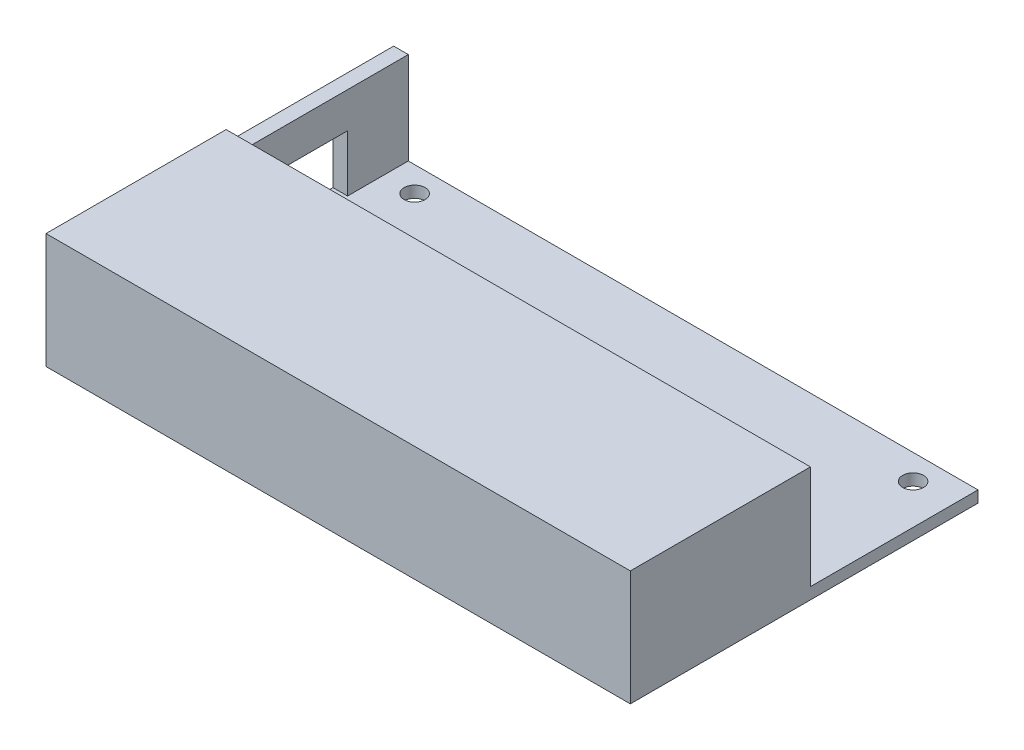
from build123d import *

# Parameters (mm, degrees)
CROQUIS1_W                = 139.5
CROQUIS1_H                = 83
SALIENTE_EXTRUIR1_DEPTH   = 27.5
CORTAR_EXTRUIR1_START     = -66.254131909
CORTAR_EXTRUIR1_OUTLINE_W = 22
CORTAR_EXTRUIR1_OUTLINE_H = 80
CORTAR_EXTRUIR1_DEPTH     = 132.508263818
CORTAR_EXTRUIR2_DEPTH     = 40
CROQUIS6_W                = 30
CROQUIS6_H                = 13.5
CROQUIS6_W_2              = 16.5
CORTAR_EXTRUIR3_DEPTH     = 3.495868091
CROQUIS7_R                = 2.5
CROQUIS7_W                = 21
CROQUIS7_H                = 30
CORTAR_EXTRUIR4_DEPTH     = 85.85207717


# Read off the part's stored shape, not the designer's step: Cortar-Extruir1
with BuildPart() as part:
    # Croquis1 → Saliente-Extruir1 (new body)
    with BuildSketch(Plane(origin=(0, 0, 0), x_dir=(1, 0, 0), z_dir=(0, 1, 0))):
        Rectangle(CROQUIS1_W, CROQUIS1_H)
    extrude(amount=SALIENTE_EXTRUIR1_DEPTH)

    # Cortar-Extruir1 outline → Cortar-Extruir1 (cut)
    with BuildSketch(Plane.YZ.offset(CORTAR_EXTRUIR1_START)):
        with Locations((13.75, -1.5)):
            Rectangle(CORTAR_EXTRUIR1_OUTLINE_W, CORTAR_EXTRUIR1_OUTLINE_H)
    extrude(amount=CORTAR_EXTRUIR1_DEPTH, mode=Mode.SUBTRACT)

    # Croquis3 → Cortar-Extruir2 (cut)
    with BuildSketch(Plane(origin=(0, 0, -41.5), x_dir=(-1, 0, 0), z_dir=(0, 0, -1))):
        Polygon((-66.254131909, 24.75), (67.373989774, 24.75), (69.75, 24.75), (69.75, 27.5), (67.373989774, 27.5), (-64.5, 27.5), (-69.75, 27.5), (-69.75, 23.25), (-69.75, 2.75), (-66.254131909, 2.75), align=None)
    extrude(amount=-CORTAR_EXTRUIR2_DEPTH, mode=Mode.SUBTRACT)

    # Croquis6 → Cortar-Extruir3 (cut)
    with BuildSketch(Plane(origin=(-66.254131909, 0, 0), x_dir=(0, 0, -1), z_dir=(1, 0, 0))):
        with Locations((-9.5, 9.5)):
            Rectangle(CROQUIS6_W, CROQUIS6_H)
        with Locations((18.75, 9.5)):
            Rectangle(CROQUIS6_W_2, CROQUIS6_H)
    extrude(amount=-CORTAR_EXTRUIR3_DEPTH, mode=Mode.SUBTRACT)

    # Croquis7 → Cortar-Extruir4 (cut, through all)
    with BuildSketch(Plane(origin=(0, 2.75, 0), x_dir=(1, 0, 0), z_dir=(0, 1, 0))):
        with Locations(Location((-58.754131909, 35.5, 0), (0, 0, 270))):
            Circle(CROQUIS7_R)
        with Locations(Location((60.25, 35.5, 0), (0, 0, 270))):
            Circle(CROQUIS7_R)
        with Locations((-59.25, -9.5)):
            Rectangle(CROQUIS7_W, CROQUIS7_H)
    extrude(amount=-CORTAR_EXTRUIR4_DEPTH, mode=Mode.SUBTRACT)


solid = part.part
